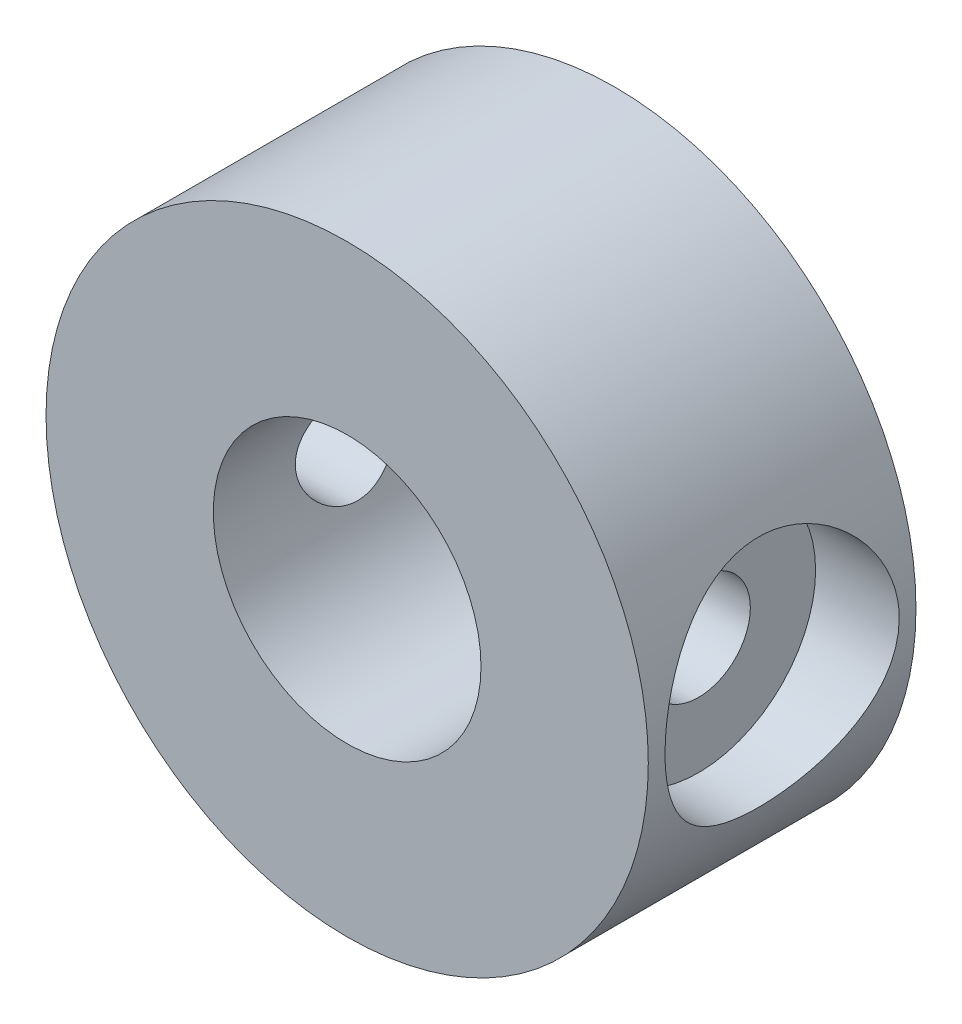
from build123d import *

# Parameters (mm, degrees)
SKETCH1_R                           = 9
SKETCH1_R_2                         = 4
BOSS_EXTRUDE1_DEPTH                 = 8
CUT_EXTRUDE1_REACH                  = 17.033
CUT_EXTRUDE1_END_RADIUS             = 9
SKETCH2_R                           = 1.55
CUT_EXTRUDE1_DIRECTION_2_REACH      = 17.033
CUT_EXTRUDE1_DIRECTION_2_END_RADIUS = 9
CUT_EXTRUDE3_START                  = 9
SKETCH3_R                           = 3.5
CUT_EXTRUDE3_DEPTH                  = 2.5
CUT_EXTRUDE4_START                  = -6.5
SKETCH3_3_R                         = 3.5
CUT_EXTRUDE4_DEPTH                  = 2.5


with BuildPart() as part:
    # Sketch1 → Boss-Extrude1 (new body)
    with BuildSketch(Plane.XY):
        Circle(SKETCH1_R)
        Circle(SKETCH1_R_2, mode=Mode.SUBTRACT)
    extrude(amount=BOSS_EXTRUDE1_DEPTH)

    # Cut-Extrude1: up to this cylinder (the profile starts inside it)
    cut_extrude1_end = Plane(origin=(0, 0, 4), z_dir=(0, 0, -1)) * Cylinder(CUT_EXTRUDE1_END_RADIUS, 53.066, mode=Mode.PRIVATE)
    # Sketch2 → Cut-Extrude1 (cut, up to the surface)
    with BuildSketch(Plane(origin=(0, 0, 0), x_dir=(0, 0, -1), z_dir=(1, 0, 0)), mode=Mode.PRIVATE) as cut_extrude1_sk1:
        with Locations((-4, 0)):
            Circle(SKETCH2_R)
    cut_extrude1_tool1 = extrude(cut_extrude1_sk1.sketch, amount=-CUT_EXTRUDE1_REACH, mode=Mode.PRIVATE) & cut_extrude1_end
    add(cut_extrude1_tool1.solids().sort_by_distance((0, 0, 4))[0], mode=Mode.SUBTRACT)

    # Cut-Extrude1 direction 2: up to this cylinder (the profile starts inside it)
    cut_extrude1_direction_2_end = Plane(origin=(0, 0, 4), z_dir=(0, 0, -1)) * Cylinder(CUT_EXTRUDE1_DIRECTION_2_END_RADIUS, 53.066, mode=Mode.PRIVATE)
    # Sketch2 → Cut-Extrude1 direction 2 (cut, up to the surface)
    with BuildSketch(Plane(origin=(0, 0, 0), x_dir=(0, 0, -1), z_dir=(1, 0, 0)), mode=Mode.PRIVATE) as cut_extrude1_direction_2_sk1:
        with Locations((-4, 0)):
            Circle(SKETCH2_R)
    cut_extrude1_direction_2_tool1 = extrude(cut_extrude1_direction_2_sk1.sketch, amount=CUT_EXTRUDE1_DIRECTION_2_REACH, mode=Mode.PRIVATE) & cut_extrude1_direction_2_end
    add(cut_extrude1_direction_2_tool1.solids().sort_by_distance((0, 0, 4))[0], mode=Mode.SUBTRACT)

    # Sketch3 → Cut-Extrude3 (cut)
    with BuildSketch(Plane(origin=(0, 0, 0), x_dir=(0, 0, -1), z_dir=(1, 0, 0)).offset(CUT_EXTRUDE3_START)):
        with Locations((-4, 0)):
            Circle(SKETCH3_R)
    extrude(amount=-CUT_EXTRUDE3_DEPTH, mode=Mode.SUBTRACT)

    # Sketch3<3> → Cut-Extrude4 (cut)
    with BuildSketch(Plane(origin=(0, 0, 0), x_dir=(0, 0, -1), z_dir=(1, 0, 0)).offset(CUT_EXTRUDE4_START)):
        with Locations((-4, 0)):
            Circle(SKETCH3_3_R)
    extrude(amount=-CUT_EXTRUDE4_DEPTH, mode=Mode.SUBTRACT)


solid = part.part
